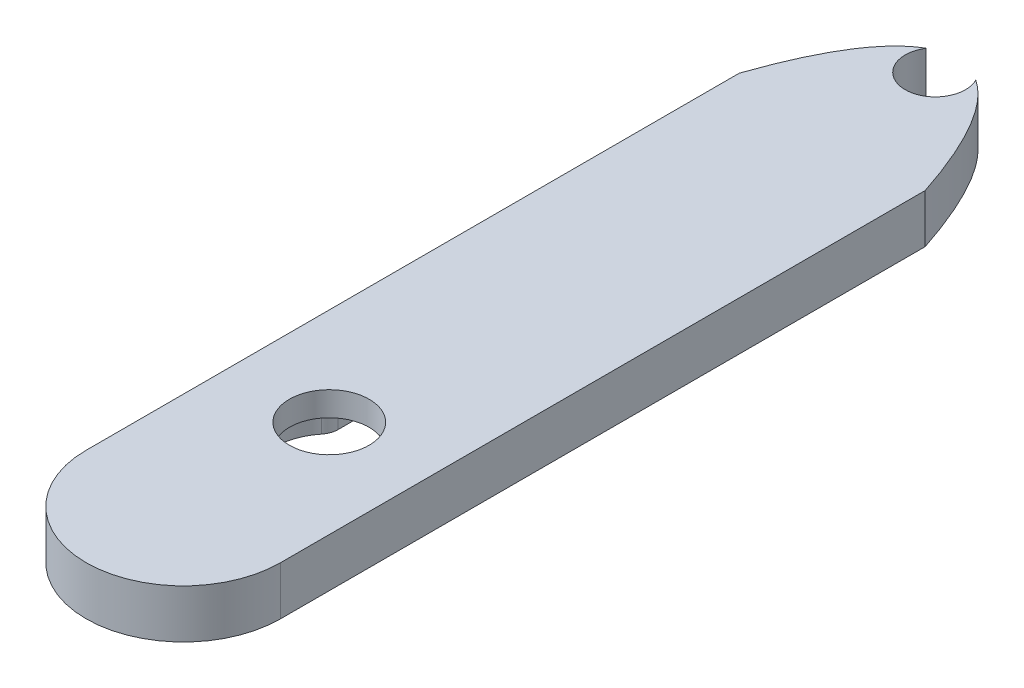
from build123d import *

# Parameters (mm, degrees)
SKETCH1_W           = 15
SKETCH1_H           = 45
BOSS_EXTRUDE1_DEPTH = 2.2
SKETCH1_3_W         = 20
SKETCH1_3_H         = 50
SKETCH1_3_W_2       = 15
SKETCH1_3_H_2       = 45
BOSS_EXTRUDE2_DEPTH = 2.5
SKETCH1_4_W         = 20
SKETCH1_4_H         = 50
SKETCH1_4_R         = 4.1
BOSS_EXTRUDE3_DEPTH = 2.5
FILLET1_R           = 2
SKETCH1_5_R         = 3.1
BOSS_EXTRUDE4_DEPTH = 2.5
FILLET2_R           = 10
CUT_EXTRUDE2_DEPTH  = 4
SKETCH3_OUTSIDE_W   = 41.892
SKETCH3_OUTSIDE_H   = 119.192
CUT_EXTRUDE3_DEPTH  = 74.159346635


with BuildPart() as part:
    # Sketch1 → Boss-Extrude1 (new body)
    with BuildSketch(Plane(origin=(0, 0, 0), x_dir=(1, 0, 0), z_dir=(0, 1, 0))):
        Rectangle(SKETCH1_W, SKETCH1_H)
        with BuildLine():
            ThreePointArc((-3.894544437, -4.023993492), (-5.599998379, 0.004260474), (-3.88841703, 4.029914763))
            Line((-3.88841703, 4.029914763), (-3.88841703, 8.505312122))
            ThreePointArc((-3.88841703, 8.505312122), (-3.870707724, 8.925763598), (-3.817705253, 9.343236712))
            Line((-3.817705253, 9.343236712), (-2.664584371, 16.126741161))
            ThreePointArc((-2.664584371, 16.126741161), (-2.610617779, 16.555799687), (-2.593926654, 16.987916591))
            ThreePointArc((-2.593926654, 16.987916591), (0, 19.6), (2.606045235, 17.000007028))
            ThreePointArc((2.606045235, 17.000007028), (2.623754541, 16.579555552), (2.676757012, 16.162082438))
            Line((2.676757012, 16.162082438), (3.829877895, 9.378577989))
            ThreePointArc((3.829877895, 9.378577989), (3.882880366, 8.961104875), (3.900589672, 8.540653399))
            Line((3.900589672, 8.540653399), (3.900589672, 4.018133922))
            ThreePointArc((3.900589672, 4.018133922), (5.157678846, 2.181364004), (5.6, 0))
            ThreePointArc((5.6, 0), (5.156037667, -2.185240393), (3.894544437, -4.023993492))
            Line((3.894544437, -4.023993492), (3.894544437, -8.540646372))
            ThreePointArc((3.894544437, -8.540646372), (3.876835131, -8.961097847), (3.82383266, -9.378570962))
            Line((3.82383266, -9.378570962), (2.670711777, -16.16207541))
            ThreePointArc((2.670711777, -16.16207541), (2.617709306, -16.579548524), (2.6, -17))
            ThreePointArc((2.6, -17), (0, -19.6), (-2.6, -17))
            ThreePointArc((-2.6, -17), (-2.617709306, -16.579548524), (-2.670711777, -16.16207541))
            Line((-2.670711777, -16.16207541), (-3.82383266, -9.378570962))
            ThreePointArc((-3.82383266, -9.378570962), (-3.876835131, -8.961097847), (-3.894544437, -8.540646372))
            Line((-3.894544437, -8.540646372), (-3.894544437, -4.023993492))
        make_face(mode=Mode.SUBTRACT)
    extrude(amount=-BOSS_EXTRUDE1_DEPTH)

    # Sketch1<3> → Boss-Extrude2 (add)
    # profile 1 of 2: a face of its own
    with BuildSketch(Plane(origin=(0, 0, 0), x_dir=(1, 0, 0), z_dir=(0, 1, 0))):
        Rectangle(SKETCH1_3_W, SKETCH1_3_H)
        Rectangle(SKETCH1_3_W_2, SKETCH1_3_H_2, mode=Mode.SUBTRACT)
    # profile 2 of 2: a face of its own
    with BuildSketch(Plane(origin=(0, 0, 0), x_dir=(1, 0, 0), z_dir=(0, 1, 0))):
        Rectangle(SKETCH1_3_W_2, SKETCH1_3_H_2)
        with BuildLine():
            ThreePointArc((-3.894544437, -4.023993492), (-5.599998379, 0.004260474), (-3.88841703, 4.029914763))
            Line((-3.88841703, 4.029914763), (-3.88841703, 8.505312122))
            ThreePointArc((-3.88841703, 8.505312122), (-3.870707724, 8.925763598), (-3.817705253, 9.343236712))
            Line((-3.817705253, 9.343236712), (-2.664584371, 16.126741161))
            ThreePointArc((-2.664584371, 16.126741161), (-2.610617779, 16.555799687), (-2.593926654, 16.987916591))
            ThreePointArc((-2.593926654, 16.987916591), (0, 19.6), (2.606045235, 17.000007028))
            ThreePointArc((2.606045235, 17.000007028), (2.623754541, 16.579555552), (2.676757012, 16.162082438))
            Line((2.676757012, 16.162082438), (3.829877895, 9.378577989))
            ThreePointArc((3.829877895, 9.378577989), (3.882880366, 8.961104875), (3.900589672, 8.540653399))
            Line((3.900589672, 8.540653399), (3.900589672, 4.018133922))
            ThreePointArc((3.900589672, 4.018133922), (5.157678846, 2.181364004), (5.6, 0))
            ThreePointArc((5.6, 0), (5.156037667, -2.185240393), (3.894544437, -4.023993492))
            Line((3.894544437, -4.023993492), (3.894544437, -8.540646372))
            ThreePointArc((3.894544437, -8.540646372), (3.876835131, -8.961097847), (3.82383266, -9.378570962))
            Line((3.82383266, -9.378570962), (2.670711777, -16.16207541))
            ThreePointArc((2.670711777, -16.16207541), (2.617709306, -16.579548524), (2.6, -17))
            ThreePointArc((2.6, -17), (0, -19.6), (-2.6, -17))
            ThreePointArc((-2.6, -17), (-2.617709306, -16.579548524), (-2.670711777, -16.16207541))
            Line((-2.670711777, -16.16207541), (-3.82383266, -9.378570962))
            ThreePointArc((-3.82383266, -9.378570962), (-3.876835131, -8.961097847), (-3.894544437, -8.540646372))
            Line((-3.894544437, -8.540646372), (-3.894544437, -4.023993492))
        make_face(mode=Mode.SUBTRACT)
    extrude(amount=-BOSS_EXTRUDE2_DEPTH)

    # Sketch1<4> → Boss-Extrude3 (add)
    with BuildSketch(Plane(origin=(0, 0, 0), x_dir=(1, 0, 0), z_dir=(0, 1, 0))):
        Rectangle(SKETCH1_4_W, SKETCH1_4_H)
        with Locations(Location((0, 0, 0), (0, 0, 270))):
            Circle(SKETCH1_4_R, mode=Mode.SUBTRACT)
    extrude(amount=BOSS_EXTRUDE3_DEPTH)

    # Fillet1
    fillet1_edges = [part.edges().sort_by_distance(p)[0] for p in [
        (-3.88841703, -1.25, -4.029914763),
        (-3.894544437, -1.25, 4.023993492),
        (3.894544437, -1.25, 4.023993492),
        (3.900589672, -1.25, -4.018133922),
    ]]
    fillet(fillet1_edges, radius=FILLET1_R)

    # Sketch1<5> → Boss-Extrude4 (add, symmetric)
    with BuildSketch(Plane(origin=(0, 0, 0), x_dir=(1, 0, 0), z_dir=(0, 1, 0))):
        with BuildLine():
            ThreePointArc((-10, 62.3), (0, 72.3), (10, 62.3))
            Line((10, 62.3), (10, 25))
            Line((10, 25), (-10, 25))
            Line((-10, 25), (-10, 62.3))
        make_face()
        with Locations(Location((0, 62.3, 0), (0, 0, 270))):
            Circle(SKETCH1_5_R, mode=Mode.SUBTRACT)
    extrude(amount=BOSS_EXTRUDE4_DEPTH, both=True)

    # Fillet2
    fillet2_edges = [part.edges().sort_by_distance(p)[0] for p in [
        (10, 0, 25),
        (-10, 0, 25),
    ]]
    fillet(fillet2_edges, radius=FILLET2_R - 0.0001)  # a hair under: the kernel refuses the full size

    # Sketch2 → Cut-Extrude2 (cut)
    # profile 1 of 4: a face of its own
    with BuildSketch(Plane.XZ.offset(2.5)):
        Polygon((5.973502692, -40.744870683), (-2.986751346, -35.571665602), (-2.986751346, -45.918075763), align=None)
        Polygon((5.773502692, -40.744870683), (-2.886751346, -35.744870683), (-2.886751346, -45.744870683), align=None, mode=Mode.SUBTRACT)
    # profile 2 of 4: a face of its own
    with BuildSketch(Plane.XZ.offset(2.5)):
        Polygon((5.973502692, -24.744870683), (-2.986751346, -19.571665602), (-2.986751346, -29.918075763), align=None)
        Polygon((5.773502692, -24.744870683), (-2.886751346, -19.744870683), (-2.886751346, -29.744870683), align=None, mode=Mode.SUBTRACT)
    # profile 3 of 4: a face of its own
    with BuildSketch(Plane.XZ.offset(2.5)):
        Polygon((-3.086751346, -48.744870683), (5.873502692, -43.571665602), (5.873502692, -53.918075763), align=None)
        Polygon((5.773502692, -53.744870683), (-2.886751346, -48.744870683), (5.773502692, -43.744870683), align=None, mode=Mode.SUBTRACT)
    # profile 4 of 4: a face of its own
    with BuildSketch(Plane.XZ.offset(2.5)):
        Polygon((-3.086751346, -32.744870683), (5.873502692, -27.571665602), (5.873502692, -37.918075763), align=None)
        Polygon((5.773502692, -37.744870683), (-2.886751346, -32.744870683), (5.773502692, -27.744870683), align=None, mode=Mode.SUBTRACT)
    extrude(amount=-CUT_EXTRUDE2_DEPTH, mode=Mode.SUBTRACT)

    # Sketch3 outside → Cut-Extrude3 (cut, through all)
    with BuildSketch(Plane.XZ.offset(2.5)):
        with Locations((0, -23.65)):
            Rectangle(SKETCH3_OUTSIDE_W, SKETCH3_OUTSIDE_H)
        with BuildLine():
            Line((10, -51.256214284), (10, 15))
            ThreePointArc((10, 15), (7.071067812, 22.071067812), (0, 25))
            ThreePointArc((0, 25), (-7.071067812, 22.071067812), (-10, 15))
            Line((-10, 15), (-10, -52.147572729))
            add(Edge.make_bspline(
                [(10, -51.256214284), (9.785135746, -51.909968828), (9.078957117, -53.953043182), (7.795150781, -57.091457155), (6.013003778, -60.33910848), (4.122796637, -62.728314915), (2.078800951, -64.258582197), (-0.15, -64.79554013), (-2.378800951, -64.258582197), (-4.422796637, -62.728314915), (-6.313003778, -60.33910848), (-8.095150781, -57.091457155), (-9.260115035, -54.243566479), (-9.877905488, -52.501784004), (-10, -52.147572729)],
                knots=[0.471097659, 0.471097659, 0.471097659, 0.471097659, 0.474472001, 0.481696232, 0.487703698, 0.492583405, 0.496543603, 0.5, 0.503456397, 0.507416595, 0.512296302, 0.518303768, 0.525527999, 0.527365119, 0.527365119, 0.527365119, 0.527365119], degree=3))
        make_face(mode=Mode.SUBTRACT)
    extrude(amount=-CUT_EXTRUDE3_DEPTH, mode=Mode.SUBTRACT)


solid = part.part
